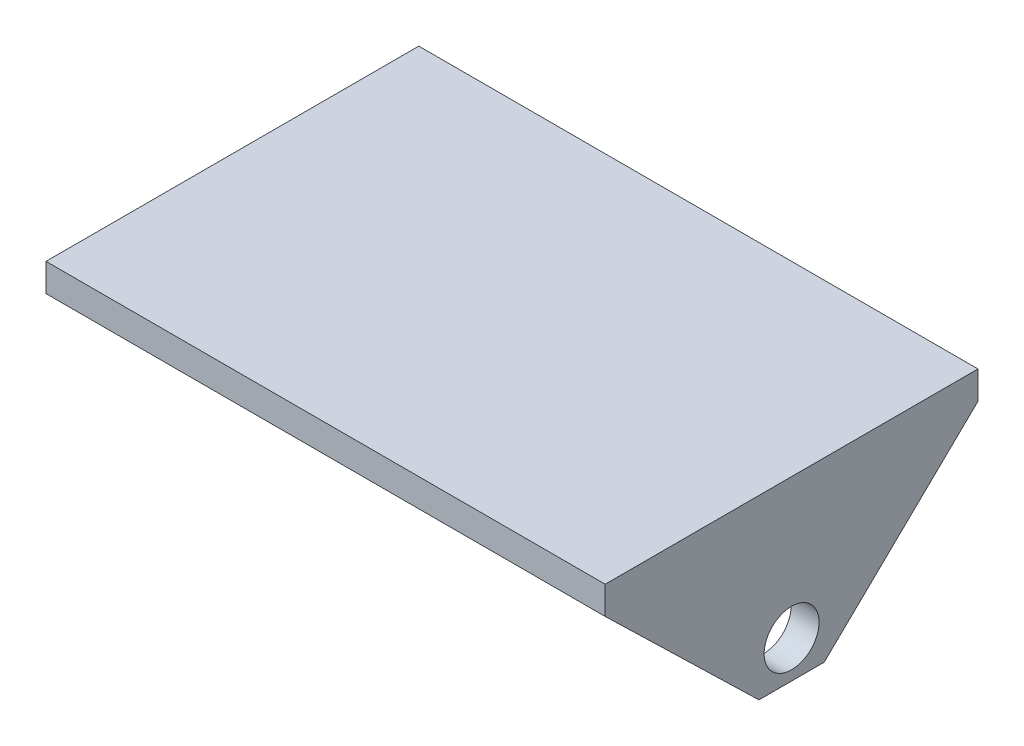
from build123d import *

# Parameters (mm, degrees)
SKETCH1_W           = 60
SKETCH1_H           = 40
BOSS_EXTRUDE1_DEPTH = 3
SKETCH2_R           = 2.95
BOSS_EXTRUDE2_DEPTH = 3


with BuildPart() as part:
    # Sketch1 → Boss-Extrude1 (new body)
    with BuildSketch(Plane(origin=(0, 0, 0), x_dir=(1, 0, 0), z_dir=(0, 1, 0))):
        Rectangle(SKETCH1_W, SKETCH1_H)
    extrude(amount=BOSS_EXTRUDE1_DEPTH)

    # Sketch2 → Boss-Extrude2 (add)
    with BuildSketch(Plane(origin=(30, 0, 0), x_dir=(0, 0, -1), z_dir=(1, 0, 0))):
        Polygon((20, 0), (-20, 0), (-3.5, -16), (3.5, -16), align=None)
        with Locations((0, -12)):
            Circle(SKETCH2_R, mode=Mode.SUBTRACT)
    boss_extrude2 = extrude(amount=-BOSS_EXTRUDE2_DEPTH)

    # Mirror1: Boss-Extrude2 across plane
    add(boss_extrude2.mirror(Plane.ZY))


solid = part.part
